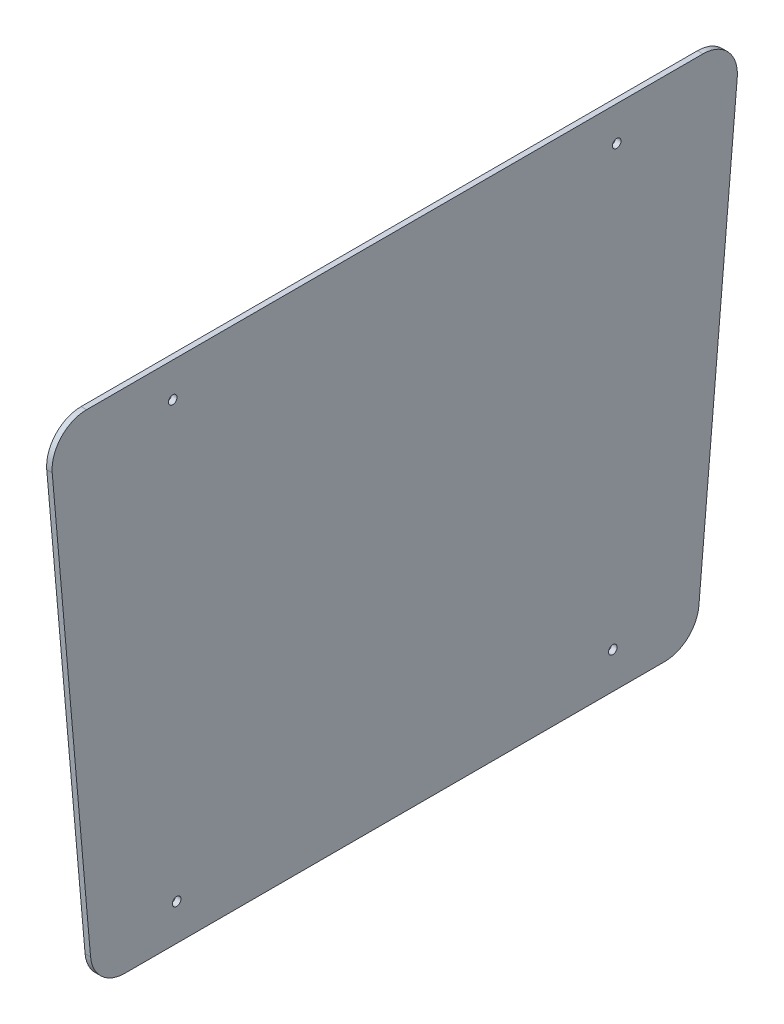
from build123d import *

# Parameters (mm, degrees)
BASE_FLANGE1_DEPTH = 3.175
FILLET1_R          = 20
SKETCH2_R          = 2.5
CUT_EXTRUDE1_DEPTH = 10


# Sheet-metal steps are written as plain solids
with BuildPart() as part:
    # Sketch1 → Base-Flange1 (new body)
    with BuildSketch(Plane(origin=(0, 0, 0), x_dir=(0, 0, -1), z_dir=(1, 0, 0))):
        Polygon((0, 0), (-25.767161182, 294.52), (375.792838818, 294.52), (350.025677637, 0), align=None)
    extrude(amount=-BASE_FLANGE1_DEPTH)

    # Fillet1
    fillet1_edges = [part.edges().sort_by_distance(p)[0] for p in [
        (-1.5875, 0, 0),
        (-1.5875, 294.52, 25.767161182),
        (-1.5875, 294.52, -375.792838818),
        (-1.5875, 0, -350.025677637),
    ]]
    fillet(fillet1_edges, radius=FILLET1_R)

    # Sketch2 → Cut-Extrude1 (cut)
    with BuildSketch(Plane(origin=(0, 0, 0), x_dir=(0, 0, -1), z_dir=(1, 0, 0))):
        with Locations((46.113408302, 274.52)):
            Circle(SKETCH2_R)
        with Locations((303.890562759, 274.52)):
            Circle(SKETCH2_R)
        with Locations((48.402729519, 21.11878104)):
            Circle(SKETCH2_R)
        with Locations((301.622948118, 21.11878104)):
            Circle(SKETCH2_R)
    extrude(amount=-CUT_EXTRUDE1_DEPTH, mode=Mode.SUBTRACT)


solid = part.part
